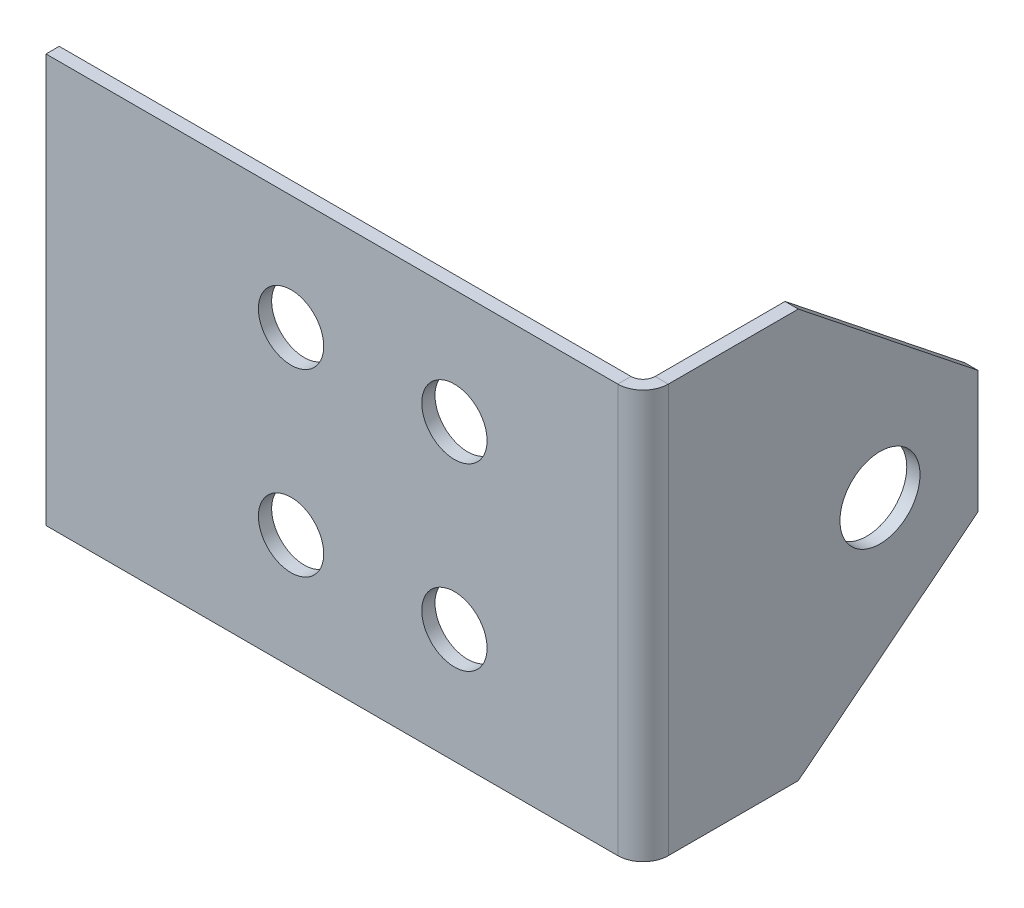
from build123d import *

# Parameters (mm, degrees)
SKETCH1_W          = 35
SKETCH1_H          = 25
BASE_FLANGE1_DEPTH = 0.81
EDGE_FLANGE1_DEPTH = 25
CUT_EXTRUDE1_REACH = 57.943
SKETCH9_R          = 2
CUT_EXTRUDE2_REACH = 57.921
SKETCH11_R         = 2.45


# Sheet-metal steps are written as plain solids
with BuildPart() as part:
    # Sketch1 → Base-Flange1 (new body)
    with BuildSketch(Plane.XY):
        with Locations((17.5, 12.5)):
            Rectangle(SKETCH1_W, SKETCH1_H)
    extrude(amount=-BASE_FLANGE1_DEPTH)

    # Edge-Flange1 section (across the edge) → Edge-Flange1 (add)
    with BuildSketch(Plane(origin=(35.7366, 25, -0.81), x_dir=(-1, 0, 0), z_dir=(0, -1, 0))):
        with BuildLine():
            Line((-0.81, 0.7366), (-0.81, 34.19))
            Line((-0.81, 34.19), (0, 34.19))
            Line((0, 34.19), (0, 0.7366))
            ThreePointArc((0, 0.7366), (0.215745145, 0.215745145), (0.7366, 0))
            Line((0.7366, 0), (0.7366, -0.81))
            ThreePointArc((0.7366, -0.81), (-0.357011348, -0.357011348), (-0.81, 0.7366))
        make_face()
    extrude(amount=EDGE_FLANGE1_DEPTH)

    # Sketch9 → Cut-Extrude1 (cut, up to next)
    with BuildSketch(Plane(origin=(0, 0, -0.81), x_dir=(-1, 0, 0), z_dir=(0, 0, -1)), mode=Mode.PRIVATE) as cut_extrude1_sk1:
        with Locations((-25, 18)):
            Circle(SKETCH9_R)
    cut_extrude1_tool1 = extrude(cut_extrude1_sk1.sketch, amount=-CUT_EXTRUDE1_REACH, mode=Mode.PRIVATE) & part.part
    # Sketch9 → Cut-Extrude1 (cut, up to next)
    with BuildSketch(Plane(origin=(0, 0, -0.81), x_dir=(-1, 0, 0), z_dir=(0, 0, -1)), mode=Mode.PRIVATE) as cut_extrude1_sk2:
        with Locations((-25, 7)):
            Circle(SKETCH9_R)
    cut_extrude1_tool2 = extrude(cut_extrude1_sk2.sketch, amount=-CUT_EXTRUDE1_REACH, mode=Mode.PRIVATE) & part.part
    # Sketch9 → Cut-Extrude1 (cut, up to next)
    with BuildSketch(Plane(origin=(0, 0, -0.81), x_dir=(-1, 0, 0), z_dir=(0, 0, -1)), mode=Mode.PRIVATE) as cut_extrude1_sk3:
        with Locations((-15, 18)):
            Circle(SKETCH9_R)
    cut_extrude1_tool3 = extrude(cut_extrude1_sk3.sketch, amount=-CUT_EXTRUDE1_REACH, mode=Mode.PRIVATE) & part.part
    # Sketch9 → Cut-Extrude1 (cut, up to next)
    with BuildSketch(Plane(origin=(0, 0, -0.81), x_dir=(-1, 0, 0), z_dir=(0, 0, -1)), mode=Mode.PRIVATE) as cut_extrude1_sk4:
        with Locations((-15, 7)):
            Circle(SKETCH9_R)
    cut_extrude1_tool4 = extrude(cut_extrude1_sk4.sketch, amount=-CUT_EXTRUDE1_REACH, mode=Mode.PRIVATE) & part.part
    add(cut_extrude1_tool1.solids().sort_by_distance((25, 18, -0.81))[0], mode=Mode.SUBTRACT)
    add(cut_extrude1_tool2.solids().sort_by_distance((25, 7, -0.81))[0], mode=Mode.SUBTRACT)
    add(cut_extrude1_tool3.solids().sort_by_distance((15, 18, -0.81))[0], mode=Mode.SUBTRACT)
    add(cut_extrude1_tool4.solids().sort_by_distance((15, 7, -0.81))[0], mode=Mode.SUBTRACT)

    # Sketch11 → Cut-Extrude2 (cut, up to next)
    with BuildSketch(Plane.ZY.offset(-35.7366), mode=Mode.PRIVATE) as cut_extrude2_sk1:
        with Locations(Location((-14.5, 12.5, 0), (0, 0, 180))):
            Circle(SKETCH11_R)
    cut_extrude2_tool1 = extrude(cut_extrude2_sk1.sketch, amount=-CUT_EXTRUDE2_REACH, mode=Mode.PRIVATE) & part.part
    # Sketch11 → Cut-Extrude2 (cut, up to next)
    with BuildSketch(Plane.ZY.offset(-35.7366), mode=Mode.PRIVATE) as cut_extrude2_sk2:
        Polygon((-9.5, 25), (-20.5, 16.25), (-20.5, 8.75), (-9.5, 0), (-14.5, 0), (-39.5, 0), (-39.5, 25), (-14.5, 25), align=None)
    cut_extrude2_tool2 = extrude(cut_extrude2_sk2.sketch, amount=-CUT_EXTRUDE2_REACH, mode=Mode.PRIVATE) & part.part
    add(cut_extrude2_tool1.solids().sort_by_distance((35.7366, 12.5, -14.5))[0], mode=Mode.SUBTRACT)
    add(cut_extrude2_tool2.solids().sort_by_distance((35.7366, 12.5, -27.781546))[0], mode=Mode.SUBTRACT)


solid = part.part
